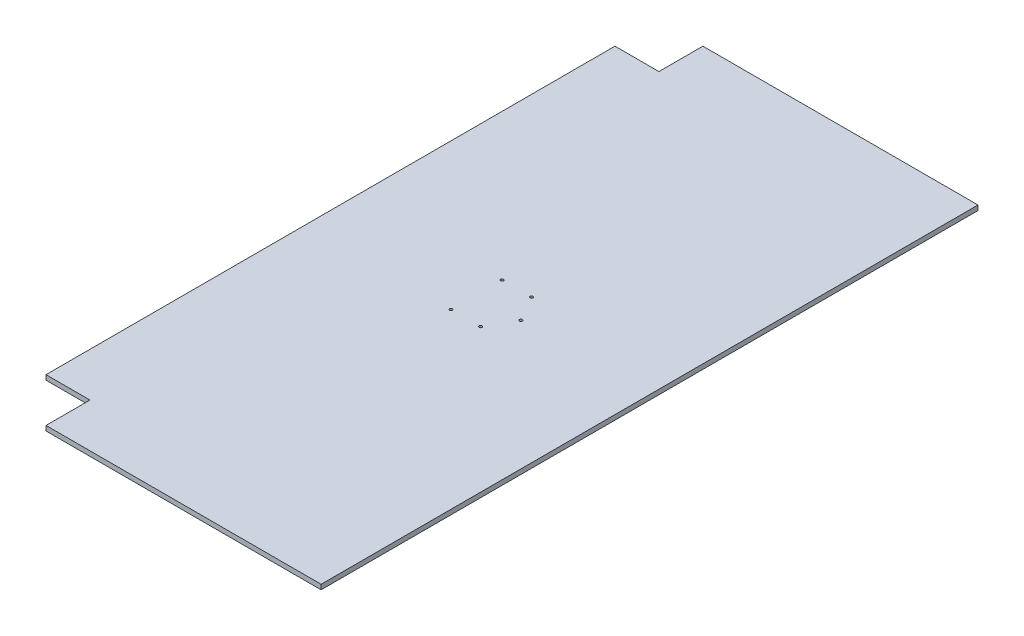
from build123d import *

# Parameters (mm, degrees)
BOSS_EXTRUDE1_DEPTH = 9
SKETCH2_W           = 14
SKETCH2_H           = 1225
CUT_EXTRUDE1_DEPTH  = 10
SKETCH3_W           = 82
SKETCH3_H           = 82
CUT_EXTRUDE5_DEPTH  = 10
SKETCH4_R           = 2.75
CUT_EXTRUDE6_DEPTH  = 10


with BuildPart() as part:
    # Sketch1 → Boss-Extrude1 (new body)
    with BuildSketch(Plane(origin=(0, 0, 0), x_dir=(1, 0, 0), z_dir=(0, 1, 0))):
        Polygon((-304.5, -532.5), (-304.5, -612.5), (224.5, -612.5), (304.5, -612.5), (304.5, -532.5), (304.5, 497.5), (304.5, 612.5), (224.5, 612.5), (-304.5, 612.5), (-304.5, 497.5), align=None)
    extrude(amount=BOSS_EXTRUDE1_DEPTH)

    # Sketch2 → Cut-Extrude1 (cut)
    with BuildSketch(Plane(origin=(0, 9, 0), x_dir=(1, 0, 0), z_dir=(0, 1, 0))):
        with Locations((297.5, 0)):
            Rectangle(SKETCH2_W, SKETCH2_H)
    extrude(amount=-CUT_EXTRUDE1_DEPTH, mode=Mode.SUBTRACT)

    # Sketch3 → Cut-Extrude5 (cut)
    with BuildSketch(Plane(origin=(0, 9, 0), x_dir=(1, 0, 0), z_dir=(0, 1, 0))):
        with Locations((-263.5, 571.5)):
            Rectangle(SKETCH3_W, SKETCH3_H)
        with Locations((-263.5, -571.5)):
            Rectangle(SKETCH3_W, SKETCH3_H)
    extrude(amount=-CUT_EXTRUDE5_DEPTH, mode=Mode.SUBTRACT)

    # Sketch4 → Cut-Extrude6 (cut)
    with BuildSketch(Plane(origin=(0, 9, 0), x_dir=(1, 0, 0), z_dir=(0, 1, 0))):
        with Locations((23, 47.631397208)):
            Circle(SKETCH4_R)
        with Locations((-32, -47.631397208)):
            Circle(SKETCH4_R)
        with Locations((23, -47.631397208)):
            Circle(SKETCH4_R)
        with Locations((50.5, 0)):
            Circle(SKETCH4_R)
        with Locations((-32, 47.631397208)):
            Circle(SKETCH4_R)
    extrude(amount=-CUT_EXTRUDE6_DEPTH, mode=Mode.SUBTRACT)


solid = part.part
